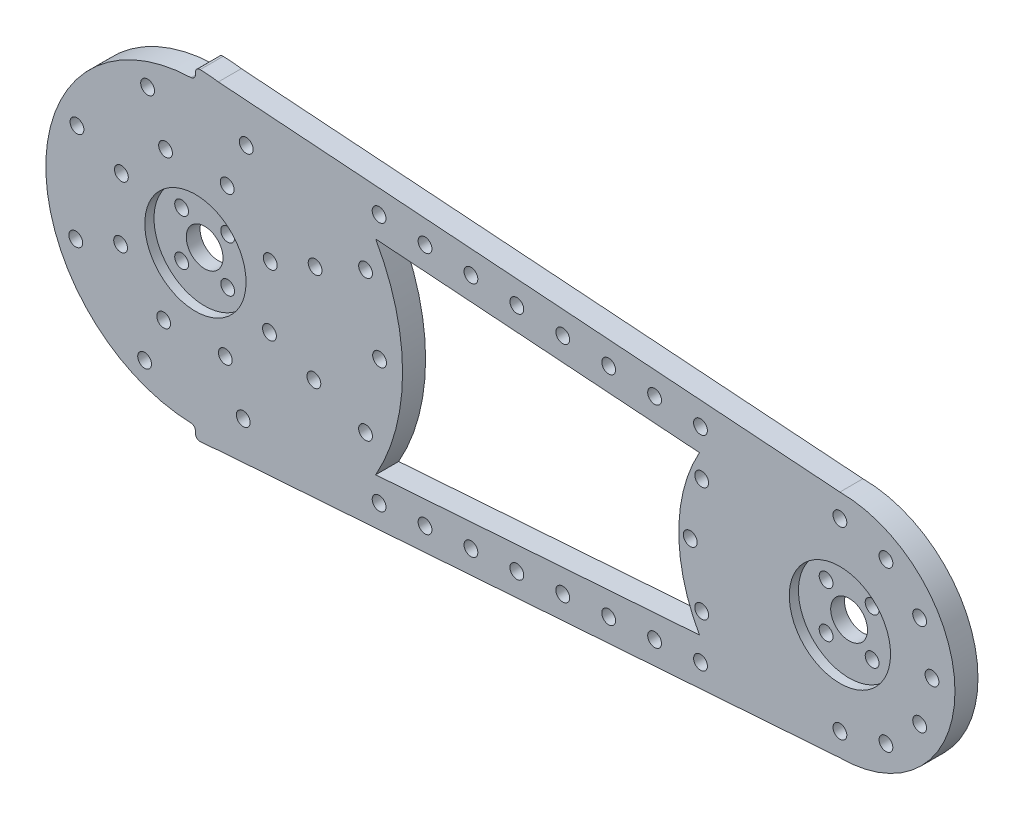
from build123d import *

# Parameters (mm, degrees)
EXTRUDE_3_DEPTH      = 5
SKETCH_4_R           = 4
SKETCH_4_R_2         = 1.5
CUT_EXTRUDE_3_DEPTH  = 5
SKETCH_5_R           = 11
CUT_EXTRUDE_4_DEPTH  = 2
SKETCH_6_R           = 1.5
CUT_EXTRUDE_6_DEPTH  = 169.745370307
SKETCH_8_R           = 1.5
CUT_EXTRUDE_8_DEPTH  = 169.745370307
SKETCH_9_R           = 1.5
EXTRUDE_4_DEPTH      = 5
SKETCH_10_R          = 1.5
EXTRUDE_6_DEPTH      = 5
SKETCH_11_R          = 1.5
EXTRUDE_12_DEPTH     = 5
SKETCH_14_R          = 1.5
CUT_EXTRUDE_9_DEPTH  = 5
EXTRUDE_START        = -5
EXTRUDE_13_DEPTH     = 5
SKETCH_16_R          = 1.5
CUT_EXTRUDE_10_DEPTH = 5
EXTRUDE_14_DEPTH     = 5
SKETCH_19_R          = 1.5
EXTRUDE_15_DEPTH     = 5
SKETCH_20_R          = 1.5
CUT_EXTRUDE_11_DEPTH = 5
EXTRUDE_16_DEPTH     = 5
SKETCH_22_R          = 1.5
EXTRUDE_17_DEPTH     = 5
SKETCH_23_R          = 1.5
CUT_EXTRUDE_15_DEPTH = 5
SKETCH_24_R          = 1.5
EXTRUDE_21_DEPTH     = 5
EXTRUDE_22_DEPTH     = 5
CUT_EXTRUDE_START    = -10
CUT_EXTRUDE_16_DEPTH = 10
FILLET_5_R           = 1
FILLET_6_R           = 1
FILLET_7_R           = 1
FILLET_8_R           = 1


with BuildPart() as part:
    # 草图1 → 凸台-拉伸3 (new body)
    with BuildSketch(Plane.XY):
        with BuildLine():
            Line((140, 25), (0, 35))
            ThreePointArc((0, 35), (-35, 0), (0, -35))
            Line((0, -35), (140, -25))
            ThreePointArc((140, -25), (165, 0), (140, 25))
        make_face()
    extrude(amount=EXTRUDE_3_DEPTH)

    # 草图4 → 切除-拉伸3 (cut)
    with BuildSketch(Plane.XY.offset(5)):
        with Locations((140, 0)):
            Circle(SKETCH_4_R)
        Circle(SKETCH_4_R)
        with BuildLine():
            Line((-5, -3.5), (-5, -5))
            Line((-5, -5), (-3.5, -5))
            ThreePointArc((-3.5, -5), (-3.939339828, -3.939339828), (-5, -3.5))
        make_face()
        with BuildLine():
            Line((-3.5, -5), (-5, -5))
            Line((-5, -5), (-5, -3.5))
            ThreePointArc((-5, -3.5), (-6.060660172, -6.060660172), (-3.5, -5))
        make_face()
        with Locations((135, 5)):
            Circle(SKETCH_4_R_2)
        with Locations((135, -5)):
            Circle(SKETCH_4_R_2)
        with Locations((145, -5)):
            Circle(SKETCH_4_R_2)
        with Locations((145, 5)):
            Circle(SKETCH_4_R_2)
        with Locations((-5, 5)):
            Circle(SKETCH_4_R_2)
        with Locations((5, 5)):
            Circle(SKETCH_4_R_2)
        with Locations((5, -5)):
            Circle(SKETCH_4_R_2)
    extrude(amount=-CUT_EXTRUDE_3_DEPTH, mode=Mode.SUBTRACT)

    # 草图5 → 切除-拉伸4 (cut)
    with BuildSketch(Plane.XY.offset(5)):
        Circle(SKETCH_5_R)
        with Locations((140, 0)):
            Circle(SKETCH_5_R)
    extrude(amount=-CUT_EXTRUDE_4_DEPTH, mode=Mode.SUBTRACT)

    # 草图6 → 切除-拉伸6 (cut, through all)
    with BuildSketch(Plane.XY.offset(5)):
        with Locations((0, 30)):
            Circle(SKETCH_6_R)
        with Locations((15, 25.980762114)):
            Circle(SKETCH_6_R)
        with Locations((25.980762114, 15)):
            Circle(SKETCH_6_R)
        with Locations((30, 0)):
            Circle(SKETCH_6_R)
        with Locations((25.980762114, -15)):
            Circle(SKETCH_6_R)
        with Locations((15, -25.980762114)):
            Circle(SKETCH_6_R)
        with Locations((0, -30)):
            Circle(SKETCH_6_R)
        with Locations((-15, -25.980762114)):
            Circle(SKETCH_6_R)
        with Locations((-25.980762114, -15)):
            Circle(SKETCH_6_R)
        with Locations((-30, 0)):
            Circle(SKETCH_6_R)
        with Locations((-25.980762114, 15)):
            Circle(SKETCH_6_R)
        with Locations((-15, 25.980762114)):
            Circle(SKETCH_6_R)
        with Locations((140, 20)):
            Circle(SKETCH_6_R)
        with Locations((150, 17.320508076)):
            Circle(SKETCH_6_R)
        with Locations((157.320508076, 10)):
            Circle(SKETCH_6_R)
        with Locations((160, 0)):
            Circle(SKETCH_6_R)
        with Locations((157.320508076, -10)):
            Circle(SKETCH_6_R)
        with Locations((150, -17.320508076)):
            Circle(SKETCH_6_R)
        with Locations((140, -20)):
            Circle(SKETCH_6_R)
        with Locations((130, -17.320508076)):
            Circle(SKETCH_6_R)
        with Locations((122.679491924, -10)):
            Circle(SKETCH_6_R)
        with Locations((120, 0)):
            Circle(SKETCH_6_R)
        with Locations((122.679491924, 10)):
            Circle(SKETCH_6_R)
        with Locations((130, 17.320508076)):
            Circle(SKETCH_6_R)
    extrude(amount=-CUT_EXTRUDE_6_DEPTH, mode=Mode.SUBTRACT)

    # 草图8 → 切除-拉伸8 (cut, through all)
    with BuildSketch(Plane.XY.offset(5)):
        with BuildLine():
            ThreePointArc((35, 0), (32.752250408, -12.340587232), (26.297708958, -23.096114469))
            Line((26.297708958, -23.096114469), (121.06763386, -16.326834119))
            ThreePointArc((121.06763386, -16.326834119), (115, 0), (121.06763386, 16.326834119))
            Line((121.06763386, 16.326834119), (26.297708958, 23.096114469))
            ThreePointArc((26.297708958, 23.096114469), (32.752250408, 12.340587232), (35, 0))
        make_face()
        with BuildLine():
            ThreePointArc((41.39357706, -27.03057705), (39.791477418, -25.653929951), (38.401308325, -27.244310531))
            Line((38.401308325, -27.244310531), (41.39357706, -27.03057705))
        make_face()
        with BuildLine():
            Line((41.39357706, -27.03057705), (38.401308325, -27.244310531))
            ThreePointArc((38.401308325, -27.244310531), (39.945467513, -28.649377735), (41.398347993, -27.150118))
            ThreePointArc((41.398347993, -27.150118), (41.397154785, -27.090299942), (41.39357706, -27.03057705))
        make_face()
        with Locations((9.974586998, 29.2875295)):
            Circle(SKETCH_8_R)
        with Locations((19.949173997, 28.575059)):
            Circle(SKETCH_8_R)
        with Locations((29.923760995, 27.8625885)):
            Circle(SKETCH_8_R)
        with Locations((39.898347993, 27.150118)):
            Circle(SKETCH_8_R)
        with Locations((49.872934992, 26.437647501)):
            Circle(SKETCH_8_R)
        with Locations((59.84752199, 25.725177001)):
            Circle(SKETCH_8_R)
        with Locations((69.822108988, 25.012706501)):
            Circle(SKETCH_8_R)
        with Locations((89.771282985, 23.587765501)):
            Circle(SKETCH_8_R)
        with Locations((79.796695986, 24.300236001)):
            Circle(SKETCH_8_R)
        with Locations((99.745869983, 22.875295001)):
            Circle(SKETCH_8_R)
        with Locations((109.720456981, 22.162824501)):
            Circle(SKETCH_8_R)
        with Locations((119.69504398, 21.450354001)):
            Circle(SKETCH_8_R)
        with Locations((129.669630978, 20.737883502)):
            Circle(SKETCH_8_R)
        with Locations((129.669630978, -20.737883502)):
            Circle(SKETCH_8_R)
        with Locations((119.69504398, -21.450354001)):
            Circle(SKETCH_8_R)
        with Locations((109.720456981, -22.162824501)):
            Circle(SKETCH_8_R)
        with Locations((99.745869983, -22.875295001)):
            Circle(SKETCH_8_R)
        with Locations((89.771282985, -23.587765501)):
            Circle(SKETCH_8_R)
        with Locations((79.796695986, -24.300236001)):
            Circle(SKETCH_8_R)
        with Locations((69.822108988, -25.012706501)):
            Circle(SKETCH_8_R)
        with Locations((59.84752199, -25.725177001)):
            Circle(SKETCH_8_R)
        with Locations((49.872934992, -26.437647501)):
            Circle(SKETCH_8_R)
        with Locations((29.923760995, -27.8625885)):
            Circle(SKETCH_8_R)
        with Locations((19.949173997, -28.575059)):
            Circle(SKETCH_8_R)
        with Locations((9.974586998, -29.2875295)):
            Circle(SKETCH_8_R)
    extrude(amount=-CUT_EXTRUDE_8_DEPTH, mode=Mode.SUBTRACT)

    # 草图9 → 凸台-拉伸4 (add)
    with BuildSketch(Plane.XY.offset(5)):
        with Locations((15, 25.980762114)):
            Circle(SKETCH_9_R)
        with Locations((15, -25.980762114)):
            Circle(SKETCH_9_R)
    extrude(amount=-EXTRUDE_4_DEPTH)

    # 草图10 → 凸台-拉伸6 (add)
    with BuildSketch(Plane.XY.offset(5)):
        with Locations((130, -17.320508076)):
            Circle(SKETCH_10_R)
        with Locations((130, 17.320508076)):
            Circle(SKETCH_10_R)
    extrude(amount=-EXTRUDE_6_DEPTH)

    # 草图11 → 凸台-拉伸12 (add)
    with BuildSketch(Plane.XY.offset(5)):
        with Locations((25.980762114, -15)):
            Circle(SKETCH_11_R)
        with Locations((30, 0)):
            Circle(SKETCH_11_R)
        with Locations((25.980762114, 15)):
            Circle(SKETCH_11_R)
        with Locations((119.69504398, 21.450354001)):
            Circle(SKETCH_11_R)
        with Locations((119.69504398, -21.450354001)):
            Circle(SKETCH_11_R)
        with Locations((29.923760995, -27.8625885)):
            Circle(SKETCH_11_R)
        with Locations((29.923760995, 27.8625885)):
            Circle(SKETCH_11_R)
        with Locations((19.949173997, 28.575059)):
            Circle(SKETCH_11_R)
        with Locations((19.949173997, -28.575059)):
            Circle(SKETCH_11_R)
        with BuildLine():
            Line((0, 35), (4.974619289, 34.644670051))
            ThreePointArc((4.974619289, 34.644670051), (2.49364675, 34.911054494), (0, 35))
        make_face()
        with BuildLine():
            ThreePointArc((0, -35), (2.49364675, -34.911054494), (4.974619289, -34.644670051))
            Line((4.974619289, -34.644670051), (0, -35))
        make_face()
        with Locations((129.669630978, -20.737883502)):
            Circle(SKETCH_11_R)
        with Locations((129.669630978, 20.737883502)):
            Circle(SKETCH_11_R)
        with Locations((-15, -25.980762114)):
            Circle(SKETCH_11_R)
        with Locations((0, -30)):
            Circle(SKETCH_11_R)
        with Locations((9.974586998, -29.2875295)):
            Circle(SKETCH_11_R)
        with Locations((-25.980762114, -15)):
            Circle(SKETCH_11_R)
        with Locations((-30, 0)):
            Circle(SKETCH_11_R)
        with Locations((-25.980762114, 15)):
            Circle(SKETCH_11_R)
        with Locations((-15, 25.980762114)):
            Circle(SKETCH_11_R)
        with Locations((0, 30)):
            Circle(SKETCH_11_R)
        with Locations((9.974586998, 29.2875295)):
            Circle(SKETCH_11_R)
    extrude(amount=-EXTRUDE_12_DEPTH)

    # 草图14 → 切除-拉伸9 (cut)
    with BuildSketch(Plane(origin=(0, 0, 0), x_dir=(-1, 0, 0), z_dir=(0, 0, -1))):
        with Locations((-11.039598696, 25.731833604)):
            Circle(SKETCH_14_R)
        with Locations((-6.899749185, 16.082396003)):
            Circle(SKETCH_14_R)
        with Locations((6.493111834, 16.250830708)):
            Circle(SKETCH_14_R)
        with Locations((10.388978935, 26.001329133)):
            Circle(SKETCH_14_R)
        with Locations((16.082396003, 6.899749185)):
            Circle(SKETCH_14_R)
        with Locations((25.731833604, 11.039598696)):
            Circle(SKETCH_14_R)
        with Locations((16.250830708, -6.493111834)):
            Circle(SKETCH_14_R)
        with Locations((26.001329133, -10.388978935)):
            Circle(SKETCH_14_R)
        with Locations((6.899749185, -16.082396003)):
            Circle(SKETCH_14_R)
        with Locations((11.039598696, -25.731833604)):
            Circle(SKETCH_14_R)
        with Locations((-6.493111834, -16.250830708)):
            Circle(SKETCH_14_R)
        with Locations((-10.388978935, -26.001329133)):
            Circle(SKETCH_14_R)
        with Locations((-16.082396003, -6.899749185)):
            Circle(SKETCH_14_R)
        with Locations((-25.731833604, -11.039598696)):
            Circle(SKETCH_14_R)
        with Locations((-16.250830708, 6.493111834)):
            Circle(SKETCH_14_R)
        with Locations((-26.001329133, 10.388978935)):
            Circle(SKETCH_14_R)
    extrude(amount=-CUT_EXTRUDE_9_DEPTH, mode=Mode.SUBTRACT)

    # 草图15 → 凸台-拉伸13 (add)
    with BuildSketch(Plane(origin=(0, 0, 0), x_dir=(-1, 0, 0), z_dir=(0, 0, -1)).offset(EXTRUDE_START)):
        with BuildLine():
            Line((-32.991302599, -22.618000638), (-26.297708958, -23.096114469))
            ThreePointArc((-26.297708958, -23.096114469), (-35, 0), (-26.297708958, 23.096114469))
            Line((-26.297708958, 23.096114469), (-32.991302599, 22.618000638))
            ThreePointArc((-32.991302599, 22.618000638), (-40, 0), (-32.991302599, -22.618000638))
        make_face()
    extrude(amount=EXTRUDE_13_DEPTH)

    # 草图16 → 切除-拉伸10 (cut)
    with BuildSketch(Plane(origin=(0, 0, 0), x_dir=(-1, 0, 0), z_dir=(0, 0, -1))):
        with Locations((-35, 0)):
            Circle(SKETCH_16_R)
        with Locations((-32.335783638, 13.393920133)):
            Circle(SKETCH_16_R)
        with Locations((-32.335783638, -13.393920133)):
            Circle(SKETCH_16_R)
    extrude(amount=-CUT_EXTRUDE_10_DEPTH, mode=Mode.SUBTRACT)

    # 草图18 → 凸台-拉伸14 (add)
    with BuildSketch(Plane.XY.offset(5)):
        with BuildLine():
            Line((39.15545217, 22.17770424), (32.991302599, 22.618000638))
            ThreePointArc((32.991302599, 22.618000638), (38.207670067, 11.83950793), (40, 0))
            ThreePointArc((40, 0), (38.207670067, -11.83950793), (32.991302599, -22.618000638))
            Line((32.991302599, -22.618000638), (39.15545217, -22.17770424))
            ThreePointArc((39.15545217, -22.17770424), (43.514338715, -11.467446366), (45, 0))
            ThreePointArc((45, 0), (43.514338715, 11.467446366), (39.15545217, 22.17770424))
        make_face()
    extrude(amount=-EXTRUDE_14_DEPTH)

    # 草图19 → 凸台-拉伸15 (add)
    with BuildSketch(Plane.XY.offset(5).offset(EXTRUDE_START)):
        with Locations((32.335783638, 13.393920133)):
            Circle(SKETCH_19_R)
        with Locations((35, 0)):
            Circle(SKETCH_19_R)
        with Locations((32.335783638, -13.393920133)):
            Circle(SKETCH_19_R)
    extrude(amount=EXTRUDE_15_DEPTH)

    # 草图20 → 切除-拉伸11 (cut)
    with BuildSketch(Plane(origin=(0, 0, 0), x_dir=(-1, 0, 0), z_dir=(0, 0, -1))):
        with Locations((-40, 0)):
            Circle(SKETCH_20_R)
        with Locations((-36.9551813, 15.307337295)):
            Circle(SKETCH_20_R)
        with Locations((-15.307337295, 36.9551813)):
            Circle(SKETCH_20_R)
        with Locations((0, 40)):
            Circle(SKETCH_20_R)
        with Locations((15.307337295, 36.9551813)):
            Circle(SKETCH_20_R)
        with Locations((28.284271247, 28.284271247)):
            Circle(SKETCH_20_R)
        with Locations((36.9551813, 15.307337295)):
            Circle(SKETCH_20_R)
        with Locations((40, 0)):
            Circle(SKETCH_20_R)
        with Locations((36.9551813, -15.307337295)):
            Circle(SKETCH_20_R)
        with Locations((28.284271247, -28.284271247)):
            Circle(SKETCH_20_R)
        with Locations((15.307337295, -36.9551813)):
            Circle(SKETCH_20_R)
        with Locations((0, -40)):
            Circle(SKETCH_20_R)
        with Locations((-15.307337295, -36.9551813)):
            Circle(SKETCH_20_R)
        with Locations((-36.9551813, -15.307337295)):
            Circle(SKETCH_20_R)
    extrude(amount=-CUT_EXTRUDE_11_DEPTH, mode=Mode.SUBTRACT)

    # 草图21 → 凸台-拉伸16 (add)
    with BuildSketch(Plane(origin=(0, 0, 0), x_dir=(-1, 0, 0), z_dir=(0, 0, -1))):
        with BuildLine():
            Line((-118.032774953, 16.543609755), (-121.06763386, 16.326834119))
            ThreePointArc((-121.06763386, 16.326834119), (-116.565952617, 8.70892779), (-115, 0))
            ThreePointArc((-115, 0), (-116.565952617, -8.70892779), (-121.06763386, -16.326834119))
            Line((-121.06763386, -16.326834119), (-118.032774953, -16.543609755))
            ThreePointArc((-118.032774953, -16.543609755), (-113.919847692, -8.722135954), (-112.5, 0))
            ThreePointArc((-112.5, 0), (-113.919847692, 8.722135954), (-118.032774953, 16.543609755))
        make_face()
        with BuildLine():
            Line((-115.112957921, 16.752168115), (-118.032774953, 16.543609755))
            ThreePointArc((-118.032774953, 16.543609755), (-113.919847692, 8.722135954), (-112.5, 0))
            ThreePointArc((-112.5, 0), (-113.919847692, -8.722135954), (-118.032774953, -16.543609755))
            Line((-118.032774953, -16.543609755), (-115.112957921, -16.752168115))
            ThreePointArc((-115.112957921, -16.752168115), (-111.306697102, -8.757532119), (-110, 0))
            ThreePointArc((-110, 0), (-111.306697102, 8.757532119), (-115.112957921, 16.752168115))
        make_face()
    extrude(amount=-EXTRUDE_16_DEPTH)

    # 草图22 → 凸台-拉伸17 (add)
    with BuildSketch(Plane.XY.offset(5)):
        with Locations((122.679491924, 10)):
            Circle(SKETCH_22_R)
        with Locations((120, 0)):
            Circle(SKETCH_22_R)
        with Locations((122.679491924, -10)):
            Circle(SKETCH_22_R)
    extrude(amount=-EXTRUDE_17_DEPTH)

    # 草图23 → 切除-拉伸15 (cut)
    with BuildSketch(Plane.XY.offset(5)):
        with Locations((112.5, 0)):
            Circle(SKETCH_23_R)
        with Locations((116.184301396, 13.75)):
            Circle(SKETCH_23_R)
        with Locations((116.184301396, -13.75)):
            Circle(SKETCH_23_R)
    extrude(amount=-CUT_EXTRUDE_15_DEPTH, mode=Mode.SUBTRACT)

    # 草图24 → 凸台-拉伸21 (add)
    with BuildSketch(Plane.XY.offset(5)):
        with Locations((116.184301396, 13.75)):
            Circle(SKETCH_24_R)
        with Locations((112.5, 0)):
            Circle(SKETCH_24_R)
        with Locations((116.184301396, -13.75)):
            Circle(SKETCH_24_R)
    extrude(amount=-EXTRUDE_21_DEPTH)

    # 草图29 → 凸台-拉伸22 (add)
    with BuildSketch(Plane.XY.offset(5).offset(EXTRUDE_START)):
        with BuildLine():
            ThreePointArc((115.112957921, -16.752168115), (110, 0), (115.112957921, 16.752168115))
            Line((115.112957921, 16.752168115), (112.273160836, 16.955010763))
            ThreePointArc((112.273160836, 16.955010763), (111.38321068, 15.405498012), (110.57976792, 13.809415062))
            ThreePointArc((110.57976792, 13.809415062), (111.230652853, 13.256119639), (111.473915193, 12.437211552))
            ThreePointArc((111.473915193, 12.437211552), (110.821606837, 11.19970645), (109.432023357, 11.038514573))
            ThreePointArc((109.432023357, 11.038514573), (108.124478387, 6.340435466), (107.534615385, 1.499600539))
            ThreePointArc((107.534615385, 1.499600539), (108.572828755, 1.048350352), (109, 0))
            ThreePointArc((109, 0), (108.572828755, -1.048350352), (107.534615385, -1.499600539))
            ThreePointArc((107.534615385, -1.499600539), (108.124478387, -6.340435466), (109.432023357, -11.038514573))
            ThreePointArc((109.432023357, -11.038514573), (110.821606837, -11.19970645), (111.473915193, -12.437211552))
            ThreePointArc((111.473915193, -12.437211552), (111.230652853, -13.256119639), (110.57976792, -13.809415062))
            ThreePointArc((110.57976792, -13.809415062), (111.38321068, -15.405498012), (112.273160836, -16.955010763))
            Line((112.273160836, -16.955010763), (115.112957921, -16.752168115))
        make_face()
        with BuildLine():
            ThreePointArc((110.57976792, 13.809415062), (111.38321068, 15.405498012), (112.273160836, 16.955010763))
            Line((112.273160836, 16.955010763), (109.491783992, 17.153680538))
            ThreePointArc((109.491783992, 17.153680538), (105, 0), (109.491783992, -17.153680538))
            Line((109.491783992, -17.153680538), (112.273160836, -16.955010763))
            ThreePointArc((112.273160836, -16.955010763), (111.38321068, -15.405498012), (110.57976792, -13.809415062))
            ThreePointArc((110.57976792, -13.809415062), (108.588095895, -13.0112367), (109.432023357, -11.038514573))
            ThreePointArc((109.432023357, -11.038514573), (108.124478387, -6.340435466), (107.534615385, -1.499600539))
            ThreePointArc((107.534615385, -1.499600539), (106, 0), (107.534615385, 1.499600539))
            ThreePointArc((107.534615385, 1.499600539), (108.124478387, 6.340435466), (109.432023357, 11.038514573))
            ThreePointArc((109.432023357, 11.038514573), (108.588095895, 13.0112367), (110.57976792, 13.809415062))
        make_face()
    extrude(amount=EXTRUDE_22_DEPTH)

    # 草图30 → 切除-拉伸16 (cut)
    with BuildSketch(Plane(origin=(0, 0, 0), x_dir=(-1, 0, 0), z_dir=(0, 0, -1)).offset(CUT_EXTRUDE_START)):
        with BuildLine():
            Line((0, 35), (0, 32.5))
            ThreePointArc((0, 32.5), (22.980970389, 22.980970389), (32.5, 0))
            ThreePointArc((32.5, 0), (22.980970389, -22.980970389), (0, -32.5))
            Line((0, -32.5), (0, -35))
            ThreePointArc((0, -35), (24.748737342, -24.748737342), (35, 0))
            ThreePointArc((35, 0), (24.748737342, 24.748737342), (0, 35))
        make_face()
    extrude(amount=CUT_EXTRUDE_16_DEPTH, mode=Mode.SUBTRACT)

    # 圆角5
    fillet_5_edges = [part.edges().sort_by_distance(p)[0] for p in [
        (0, 35, 2.5),
    ]]
    fillet(fillet_5_edges, radius=FILLET_5_R)

    # 圆角6
    fillet_6_edges = [part.edges().sort_by_distance(p)[0] for p in [
        (0, -35, 2.5),
    ]]
    fillet(fillet_6_edges, radius=FILLET_6_R)

    # 圆角7
    fillet_7_edges = [part.edges().sort_by_distance(p)[0] for p in [
        (0, -32.5, 2.5),
    ]]
    fillet(fillet_7_edges, radius=FILLET_7_R)

    # 圆角8
    fillet_8_edges = [part.edges().sort_by_distance(p)[0] for p in [
        (0, 32.5, 2.5),
    ]]
    fillet(fillet_8_edges, radius=FILLET_8_R)


solid = part.part
